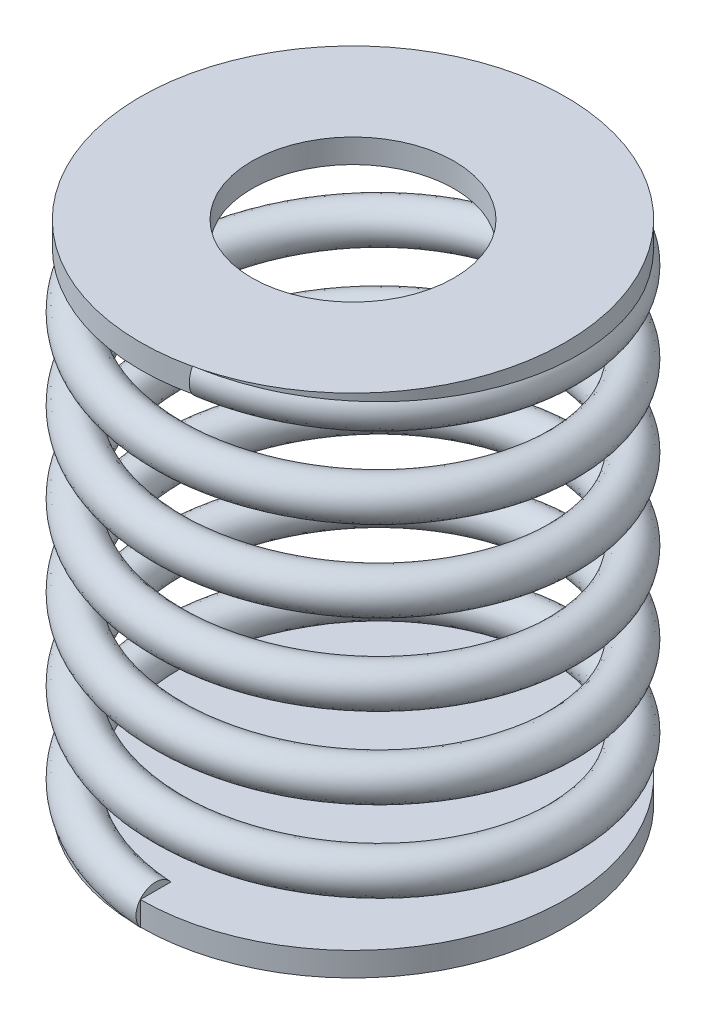
from build123d import *

# Parameters (mm, degrees)
SKETCH8_R           = 13.35
BOSS_EXTRUDE1_DEPTH = 0.75
BOSS_EXTRUDE2_START = 31.05
SKETCH8_3_R         = 13.35
BOSS_EXTRUDE2_DEPTH = 1.5
SWEEP2_PITCH        = 5.08
SKETCH5_3_R         = 12.4
CUT_EXTRUDE5_DEPTH  = 1.5
CUT_EXTRUDE6_START  = 1.5
SKETCH12_R          = 13.35
CUT_EXTRUDE6_DEPTH  = 1.5
SKETCH14_R          = 13.35
CUT_EXTRUDE7_DEPTH  = 2.5
SKETCH15_R          = 6.35
CUT_EXTRUDE8_DEPTH  = 10


with BuildPart() as part:
    # Sketch8 → Boss-Extrude1 (new, symmetric)
    with BuildSketch(Plane(origin=(0, 0, 0), x_dir=(1, 0, 0), z_dir=(0, 1, 0))):
        with Locations(Location((0, 0, 0), (0, 0, 270))):
            Circle(SKETCH8_R)
    extrude(amount=BOSS_EXTRUDE1_DEPTH, both=True)



with BuildPart() as body_2:
    # Sketch8<3> → Boss-Extrude2 (new body)
    with BuildSketch(Plane(origin=(0, 0, 0), x_dir=(1, 0, 0), z_dir=(0, 1, 0)).offset(BOSS_EXTRUDE2_START)):
        with Locations(Location((0, 0, 0), (0, 0, 270))):
            Circle(SKETCH8_3_R)
    extrude(amount=-BOSS_EXTRUDE2_DEPTH)


with BuildPart() as part_1:
    add(part.part)

    add(body_2.part)  # Sweep2 merges body 2
    # Sweep2: the profile of Sketch10 screwed along a left-hand helix of 5.964567 turns, 12 arcs to a turn; built about Z, then put on its axis
    sweep2_z = Axis((0, 0, 0), (0, 0, 1))
    sweep2_corners = [(11.175, 0, 0), (12.4, 0, 1.225), (13.625, 0, 0), (12.4, 0, -1.225)]
    with BuildLine(mode=Mode.PRIVATE) as sweep2_profile:
        ThreePointArc((11.175, 0, 0), (11.533794193, 0, 0.866205807), (12.4, 0, 1.225))
        ThreePointArc((12.4, 0, 1.225), (13.266205807, 0, 0.866205807), (13.625, 0, 0))
        ThreePointArc((13.625, 0, 0), (13.266205807, 0, -0.866205807), (12.4, 0, -1.225))
        ThreePointArc((12.4, 0, -1.225), (11.533794193, 0, -0.866205807), (11.175, 0, 0))
    sweep2_cap = Face(sweep2_profile.wire())
    sweep2_arcs = [((11.175, 0, 0), (11.175, 0, 1.225), (12.4, 0, 1.225), (1, 0.7071067811865476, 1)), ((12.4, 0, 1.225), (13.625, 0, 1.225), (13.625, 0, 0), (1, 0.7071067811865476, 1)), ((13.625, 0, 0), (13.625, 0, -1.225), (12.4, 0, -1.225), (1, 0.7071067811865476, 1)), ((12.4, 0, -1.225), (11.175, 0, -1.225), (11.175, 0, 0), (1, 0.7071067811865476, 1))]  # start, shoulder, end, weights
    sweep2_turn_angles = [0, -15, -30, -45, -60, -75, -90, -105, -120, -135, -150, -165, -180, -195, -210, -225, -240, -255, -270, -285, -300, -315, -330, -345, -360]
    sweep2_turn_weights = [1, 0.9659258262890683, 1, 0.9659258262890683, 1, 0.9659258262890683, 1, 0.9659258262890683, 1, 0.9659258262890683, 1, 0.9659258262890683, 1, 0.9659258262890683, 1, 0.9659258262890683, 1, 0.9659258262890683, 1, 0.9659258262890683, 1, 0.9659258262890683, 1, 0.9659258262890683, 1]
    sweep2_turn_sides = [Face.make_bezier_surface([[Vector(p[j][0], p[j][1], 0).rotate(sweep2_z, sweep2_turn_angles[2 * i + k]) / sweep2_turn_weights[2 * i + k] + Vector(0, 0, p[j][2] + -SWEEP2_PITCH * sweep2_turn_angles[2 * i + k] / 360) for k in range(3)] for j in range(3)], [[p[3][j] * sweep2_turn_weights[2 * i + k] for k in range(3)] for j in range(3)]) for p in sweep2_arcs for i in range(12)]
    sweep2_last_angles = [-1800, -1815, -1830, -1845, -1860, -1875, -1890, -1905, -1920, -1935, -1950, -1965, -1980, -1995, -2010, -2025, -2040, -2055, -2070, -2085, -2100, -2115, -2130, -2138.622047244, -2147.244094488]
    sweep2_last_weights = [1, 0.9659258262890683, 1, 0.9659258262890683, 1, 0.9659258262890683, 1, 0.9659258262890683, 1, 0.9659258262890683, 1, 0.9659258262890683, 1, 0.9659258262890683, 1, 0.9659258262890683, 1, 0.9659258262890683, 1, 0.9659258262890683, 1, 0.9659258262890683, 1, 0.9886987670948462, 1]
    sweep2_last_sides = [Face.make_bezier_surface([[Vector(p[j][0], p[j][1], 0).rotate(sweep2_z, sweep2_last_angles[2 * i + k]) / sweep2_last_weights[2 * i + k] + Vector(0, 0, p[j][2] + -SWEEP2_PITCH * sweep2_last_angles[2 * i + k] / 360) for k in range(3)] for j in range(3)], [[p[3][j] * sweep2_last_weights[2 * i + k] for k in range(3)] for j in range(3)]) for p in sweep2_arcs for i in range(12)]
    sweep2 = Plane(origin=(0, 0, 0), x_dir=(0, 0, 1), z_dir=(0, 1, 0)) * Solid(Shell([*[p.moved(Location((0, 0, SWEEP2_PITCH * i))) for i in range(5) for p in sweep2_turn_sides], *sweep2_last_sides, sweep2_cap, sweep2_cap.rotate(sweep2_z, -2147.244094488).moved(Location((0, 0, -SWEEP2_PITCH * -2147.244094488 / 360)))]))
    add(sweep2)

    # Sketch5<3> → Cut-Extrude5 (cut)
    with BuildSketch(Plane(origin=(0, 0, 0), x_dir=(1, 0, 0), z_dir=(0, 1, 0))):
        with Locations(Location((0, 0, 0), (0, 0, 270))):
            Circle(SKETCH5_3_R)
    extrude(amount=-CUT_EXTRUDE5_DEPTH, mode=Mode.SUBTRACT)

    # Sketch12 → Cut-Extrude6 (cut)
    with BuildSketch(Plane(origin=(0, 31.05, 0), x_dir=(1, 0, 0), z_dir=(0, 1, 0)).offset(CUT_EXTRUDE6_START)):
        Circle(SKETCH12_R)
    extrude(amount=-CUT_EXTRUDE6_DEPTH, mode=Mode.SUBTRACT)

    # Sketch14 → Cut-Extrude7 (cut)
    with BuildSketch(Plane.XZ.offset(0.75)):
        Circle(SKETCH14_R)
    extrude(amount=CUT_EXTRUDE7_DEPTH, mode=Mode.SUBTRACT)

    # Sketch15 → Cut-Extrude8 (cut)
    with BuildSketch(Plane(origin=(0, 31.05, 0), x_dir=(1, 0, 0), z_dir=(0, 1, 0))):
        with Locations(Location((0, 0, 0), (0, 0, 270))):
            Circle(SKETCH15_R)
    extrude(amount=-CUT_EXTRUDE8_DEPTH, mode=Mode.SUBTRACT)


solid = part_1.part
